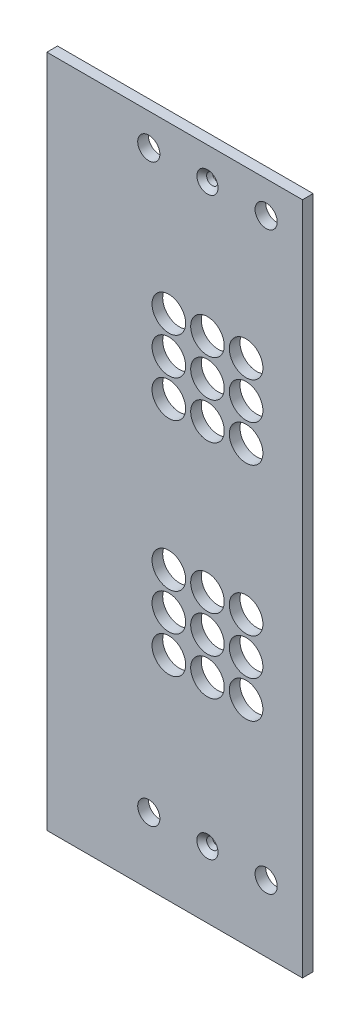
from build123d import *

# Parameters (mm, degrees)
SKETCH1_W                                       = 56.55
SKETCH1_H                                       = 197.425
BOSS_EXTRUDE1_DEPTH                             = 3.175
SKETCH2_R                                       = 5
CUT_EXTRUDE1_DEPTH                              = 103.731270343
SKETCH5_W                                       = 3.175
SKETCH5_H                                       = 197.425
BOSS_EXTRUDE2_DEPTH                             = 19.525
SKETCH14_W                                      = 76.075
SKETCH14_H                                      = 3.175
BOSS_EXTRUDE3_DEPTH                             = 3.175
M6_CLEARANCE_HOLE1_D                            = 6.6
CSK_FOR_M3_FLAT_HEAD_MACHINE_SCREW3_D           = 3.4
CSK_FOR_M3_FLAT_HEAD_MACHINE_SCREW3_CSINK_D     = 6.3
CSK_FOR_M3_FLAT_HEAD_MACHINE_SCREW3_CSINK_ANGLE = 90


with BuildPart() as part:
    # Sketch1 → Boss-Extrude1 (new body)
    with BuildSketch(Plane.XY):
        Rectangle(SKETCH1_W, SKETCH1_H)
    extrude(amount=BOSS_EXTRUDE1_DEPTH)

    # Sketch2 → Cut-Extrude1 (cut, through all)
    with BuildSketch(Plane(origin=(0, 0, 0), x_dir=(-1, 0, 0), z_dir=(0, 0, -1))):
        with Locations((-11.5, 30.630837161)):
            Circle(SKETCH2_R)
        with Locations((-11.5, 52.630837161)):
            Circle(SKETCH2_R)
        with Locations((-11.5, 41.630837161)):
            Circle(SKETCH2_R)
        with Locations((0, 52.630837161)):
            Circle(SKETCH2_R)
        with Locations((0, 41.630837161)):
            Circle(SKETCH2_R)
        with Locations((0, 30.630837161)):
            Circle(SKETCH2_R)
        with Locations((11.5, 30.630837161)):
            Circle(SKETCH2_R)
        with Locations((11.5, 41.630837161)):
            Circle(SKETCH2_R)
        with Locations((11.5, 52.630837161)):
            Circle(SKETCH2_R)
        with Locations((-11.5, -35.369162839)):
            Circle(SKETCH2_R)
        with Locations((-11.5, -13.369162839)):
            Circle(SKETCH2_R)
        with Locations((-11.5, -24.369162839)):
            Circle(SKETCH2_R)
        with Locations((0, -13.369162839)):
            Circle(SKETCH2_R)
        with Locations((0, -24.369162839)):
            Circle(SKETCH2_R)
        with Locations((0, -35.369162839)):
            Circle(SKETCH2_R)
        with Locations((11.5, -35.369162839)):
            Circle(SKETCH2_R)
        with Locations((11.5, -13.369162839)):
            Circle(SKETCH2_R)
        with Locations((11.5, -24.369162839)):
            Circle(SKETCH2_R)
    extrude(amount=-CUT_EXTRUDE1_DEPTH, mode=Mode.SUBTRACT)

    # Sketch5 → Boss-Extrude2 (add)
    with BuildSketch(Plane.ZY.offset(28.275)):
        with Locations((1.5875, 0)):
            Rectangle(SKETCH5_W, SKETCH5_H)
    extrude(amount=BOSS_EXTRUDE2_DEPTH)

    # Sketch14 → Boss-Extrude3 (add)
    with BuildSketch(Plane(origin=(0, 98.7125, 0), x_dir=(1, 0, 0), z_dir=(0, 1, 0))):
        with Locations((-9.7625, -1.5875)):
            Rectangle(SKETCH14_W, SKETCH14_H)
    extrude(amount=BOSS_EXTRUDE3_DEPTH)

    # M6 Clearance Hole1 (through all)
    with Locations(Plane.XY.offset(3.175)):
        with Locations((-17.4625, 92.3625001), (17.4625, 92.3625001), (17.4625, -78.8874999), (-17.4625, -78.8874999)):
            Hole(M6_CLEARANCE_HOLE1_D / 2)

    # CSK for M3 Flat Head Machine Screw3 (through all)
    with Locations(Plane.XY.offset(3.175)):
        with Locations((0, -78.8874999), (0, 92.3625001)):
            CounterSinkHole(CSK_FOR_M3_FLAT_HEAD_MACHINE_SCREW3_D / 2, CSK_FOR_M3_FLAT_HEAD_MACHINE_SCREW3_CSINK_D / 2, counter_sink_angle=CSK_FOR_M3_FLAT_HEAD_MACHINE_SCREW3_CSINK_ANGLE)


solid = part.part
